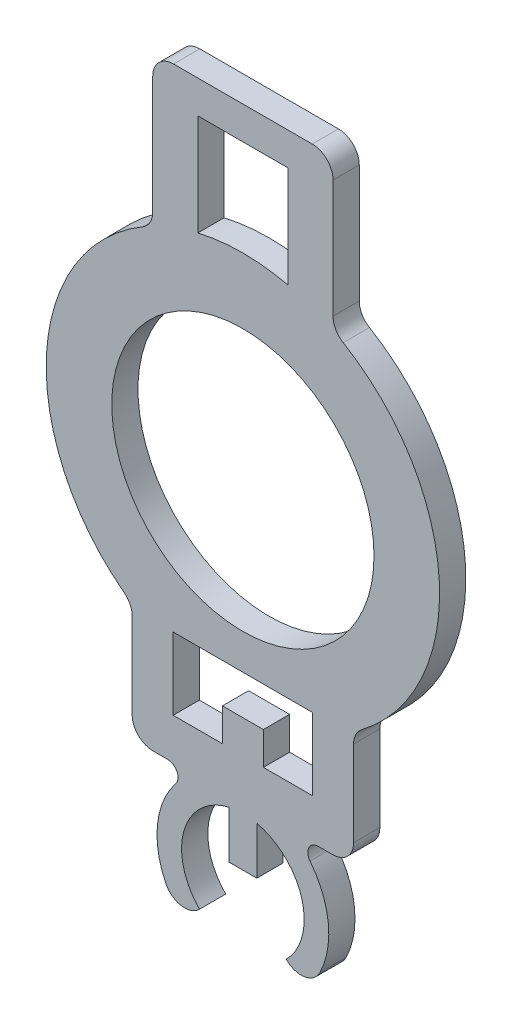
from build123d import *

# Parameters (mm, degrees)
SKETCH2_R           = 8
BOSS_EXTRUDE1_DEPTH = 1.6
FILLET1_R           = 0.635
FILLET2_R           = 1.27


with BuildPart() as part:
    # Sketch2 → Boss-Extrude1 (new body)
    with BuildSketch(Plane.XY):
        with BuildLine():
            Line((-5.5, 32.016485365), (-5.5, 41.221120861))
            Line((-5.5, 41.221120861), (5.5, 41.221120861))
            Line((5.5, 41.221120861), (5.5, 32.016485365))
            ThreePointArc((5.5, 32.016485365), (11.977775563, 22.081115767), (6.7545, 11.43261645))
            Line((6.7545, 11.43261645), (6.7545, 4.296230906))
            Line((6.7545, 4.296230906), (3, 4.296230906))
            ThreePointArc((3, 4.296230906), (5.219764516, 0.460063475), (3.705239533, -3.705239533))
            Line((3.705239533, -3.705239533), (2.644579362, -2.644579362))
            ThreePointArc((2.644579362, -2.644579362), (3.596344694, 1.026598676), (0.85, 3.642128499))
            Line((0.85, 3.642128499), (0.85, 0.74))
            Line((0.85, 0.74), (-0.85, 0.74))
            Line((-0.85, 0.74), (-0.85, 3.642128499))
            ThreePointArc((-0.85, 3.642128499), (-3.596344694, 1.026598676), (-2.644579362, -2.644579362))
            Line((-2.644579362, -2.644579362), (-3.705239533, -3.705239533))
            ThreePointArc((-3.705239533, -3.705239533), (-5.219764516, 0.460063475), (-3, 4.296230906))
            Line((-3, 4.296230906), (-6.7545, 4.296230906))
            Line((-6.7545, 4.296230906), (-6.7545, 11.43261645))
            ThreePointArc((-6.7545, 11.43261645), (-11.977775563, 22.081115767), (-5.5, 32.016485365))
        make_face()
        with Locations((0, 21.351120861)):
            Circle(SKETCH2_R, mode=Mode.SUBTRACT)
        with BuildLine():
            Line((-2.75, 39.221120861), (2.75, 39.221120861))
            Line((2.75, 39.221120861), (2.75, 33.031767248))
            ThreePointArc((2.75, 33.031767248), (0, 33.351120861), (-2.75, 33.031767248))
            Line((-2.75, 33.031767248), (-2.75, 39.221120861))
        make_face(mode=Mode.SUBTRACT)
        Polygon((-1.25, 6.796230906), (-1.25, 8.796230906), (1.25, 8.796230906), (1.25, 6.796230906), (4.2545, 6.796230906), (4.2545, 11.196230906), (-4.2545, 11.196230906), (-4.2545, 6.796230906), align=None, mode=Mode.SUBTRACT)
    extrude(amount=BOSS_EXTRUDE1_DEPTH)

    # Fillet1
    fillet1_edges = [part.edges().sort_by_distance(p)[0] for p in [
        (3, 4.296230906, 0.8),
        (-3, 4.296230906, 0.8),
    ]]
    fillet(fillet1_edges, radius=FILLET1_R)

    # Fillet2
    fillet2_edges = [part.edges().sort_by_distance(p)[0] for p in [
        (-5.5, 32.016485365, 0.8),
        (5.5, 32.016485365, 0.8),
        (-3.705239533, -3.705239533, 0.8),
        (3.705239533, -3.705239533, 0.8),
        (6.7545, 4.296230906, 0.8),
        (-6.7545, 4.296230906, 0.8),
        (-6.7545, 11.43261645, 0.8),
        (6.7545, 11.43261645, 0.8),
        (-5.5, 41.221120861, 0.8),
        (5.5, 41.221120861, 0.8),
    ]]
    fillet(fillet2_edges, radius=FILLET2_R)


solid = part.part
